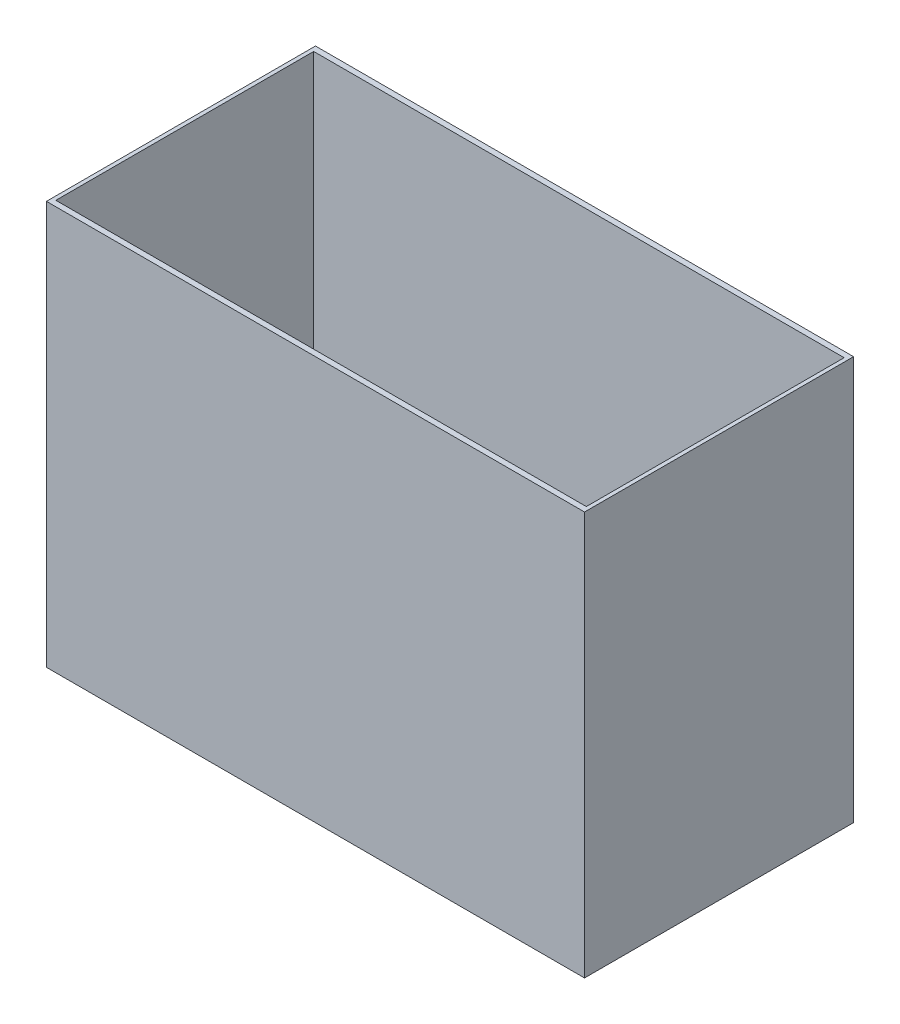
from build123d import *

# Parameters (mm, degrees)
SKETCH1_W           = 584.2
SKETCH1_H           = 279.4
BOSS_EXTRUDE1_DEPTH = 6.35
SKETCH3_W           = 609.6
SKETCH3_H           = 304.8
SKETCH3_W_2         = 600.964
SKETCH3_H_2         = 292.1
BOSS_EXTRUDE3_DEPTH = 457.2
SKETCH4_R           = 2.778125
CUT_EXTRUDE1_DEPTH  = 566.15
SKETCH6_R           = 6.35
CUT_EXTRUDE2_DEPTH  = 2.54
SKETCH7_R           = 2.778125
CUT_EXTRUDE3_DEPTH  = 566.15
SKETCH8_R           = 1.984375
CUT_EXTRUDE4_DEPTH  = 566.15
SKETCH9_R           = 6.35
CUT_EXTRUDE5_DEPTH  = 3.175
SKETCH11_W          = 50.8
SKETCH11_H          = 3.175
CUT_EXTRUDE6_DEPTH  = 571.228585744


with BuildPart() as part:
    # Sketch1 → Boss-Extrude1 (new body)
    with BuildSketch(Plane(origin=(0, 0, 0), x_dir=(1, 0, 0), z_dir=(0, 1, 0))):
        Rectangle(SKETCH1_W, SKETCH1_H)
    extrude(amount=BOSS_EXTRUDE1_DEPTH)

    # Sketch4 → Cut-Extrude1 (cut, through all)
    with BuildSketch(Plane(origin=(0, 6.35, 0), x_dir=(1, 0, 0), z_dir=(0, 1, 0))):
        with Locations((273.05, 120.65)):
            Circle(SKETCH4_R)
    cut_extrude1 = extrude(amount=-CUT_EXTRUDE1_DEPTH, mode=Mode.SUBTRACT)

    # Sketch6 → Cut-Extrude2 (cut)
    with BuildSketch(Plane.XZ):
        with Locations((273.05, -120.65)):
            Circle(SKETCH6_R)
    cut_extrude2 = extrude(amount=-CUT_EXTRUDE2_DEPTH, mode=Mode.SUBTRACT)

    # Mirror1: Cut-Extrude1, Cut-Extrude2 across plane
    add(cut_extrude1.mirror(Plane.XY), mode=Mode.SUBTRACT)
    add(cut_extrude2.mirror(Plane.XY), mode=Mode.SUBTRACT)

    # Sketch7 → Cut-Extrude3 (cut, through all)
    with BuildSketch(Plane(origin=(0, 6.35, 0), x_dir=(1, 0, 0), z_dir=(0, 1, 0))):
        with Locations((190.5, 0)):
            Circle(SKETCH7_R)
    extrude(amount=-CUT_EXTRUDE3_DEPTH, mode=Mode.SUBTRACT)

    # Sketch8 → Cut-Extrude4 (cut, through all)
    with BuildSketch(Plane(origin=(0, 6.35, 0), x_dir=(1, 0, 0), z_dir=(0, 1, 0))):
        with Locations((94.9, -12.8415)):
            Circle(SKETCH8_R)
        with Locations((146.1, -12.8415)):
            Circle(SKETCH8_R)
        with Locations((146.1, 12.8415)):
            Circle(SKETCH8_R)
        with Locations((94.9, 12.8415)):
            Circle(SKETCH8_R)
    extrude(amount=-CUT_EXTRUDE4_DEPTH, mode=Mode.SUBTRACT)

    # Sketch9 → Cut-Extrude5 (cut)
    with BuildSketch(Plane.XZ):
        with Locations((190.5, 0)):
            Circle(SKETCH9_R)
        with Locations((146.1, 12.8415)):
            Circle(SKETCH9_R)
        with Locations((94.9, 12.8415)):
            Circle(SKETCH9_R)
        with Locations((94.9, -12.8415)):
            Circle(SKETCH9_R)
        with Locations((146.1, -12.8415)):
            Circle(SKETCH9_R)
    extrude(amount=-CUT_EXTRUDE5_DEPTH, mode=Mode.SUBTRACT)

    # Sketch11 → Cut-Extrude6 (cut, through all)
    with BuildSketch(Plane.XZ):
        with Locations((190.5, 138.1125)):
            Rectangle(SKETCH11_W, SKETCH11_H)
    cut_extrude6 = extrude(amount=-CUT_EXTRUDE6_DEPTH, mode=Mode.SUBTRACT)

    # Mirror2: Cut-Extrude6 across plane
    add(cut_extrude6.mirror(Plane.XY), mode=Mode.SUBTRACT)


with BuildPart() as body_2:
    # Sketch3 → Boss-Extrude3 (new body)
    with BuildSketch(Plane(origin=(0, 0, 0), x_dir=(1, 0, 0), z_dir=(0, 1, 0))):
        Rectangle(SKETCH3_W, SKETCH3_H)
        Rectangle(SKETCH3_W_2, SKETCH3_H_2, mode=Mode.SUBTRACT)
    extrude(amount=BOSS_EXTRUDE3_DEPTH)


solid = Compound([part.part, body_2.part])
